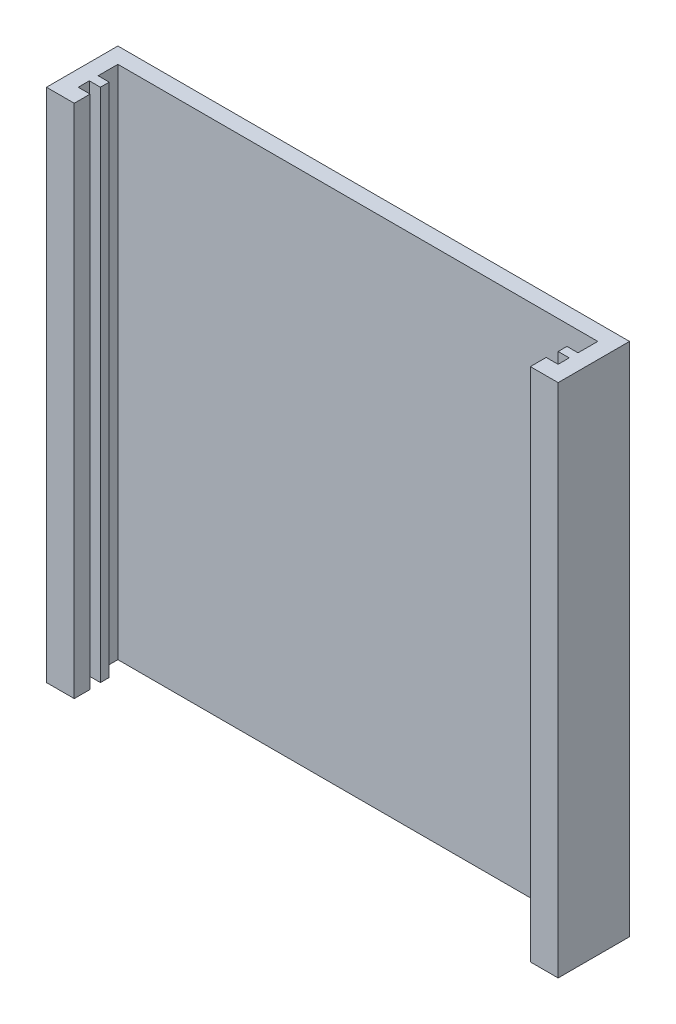
from build123d import *

# Parameters (mm, degrees)
BOSS_EXTRUDE1_DEPTH = 65


with BuildPart() as part:
    # Sketch8 → Boss-Extrude1 (new body)
    with BuildSketch(Plane(origin=(0, 0, 0), x_dir=(1, 0, 0), z_dir=(0, 1, 0))):
        Polygon((-2.697817866, 0.481305486), (56.864446285, 0.481305486), (56.864446285, -2.009260552), (55.464446285, -2.009260552), (55.464446285, -3.118694514), (56.864446285, -3.118694514), (56.864446285, -4.518694514), (55.364446285, -4.518694514), (55.364446285, -6.518694514), (58.864446285, -6.518694514), (58.864446285, 2.481305486), (-5.635553715, 2.481305486), (-5.635553715, -6.518694514), (-2.135553715, -6.518694514), (-2.135553715, -4.518694514), (-3.635553715, -4.518694514), (-3.635553715, -3.118694514), (-2.235553715, -3.118694514), (-2.235553715, -2.009260552), (-3.635553715, -2.009260552), (-3.635553715, 0.481305486), align=None)
    extrude(amount=BOSS_EXTRUDE1_DEPTH)


solid = part.part
